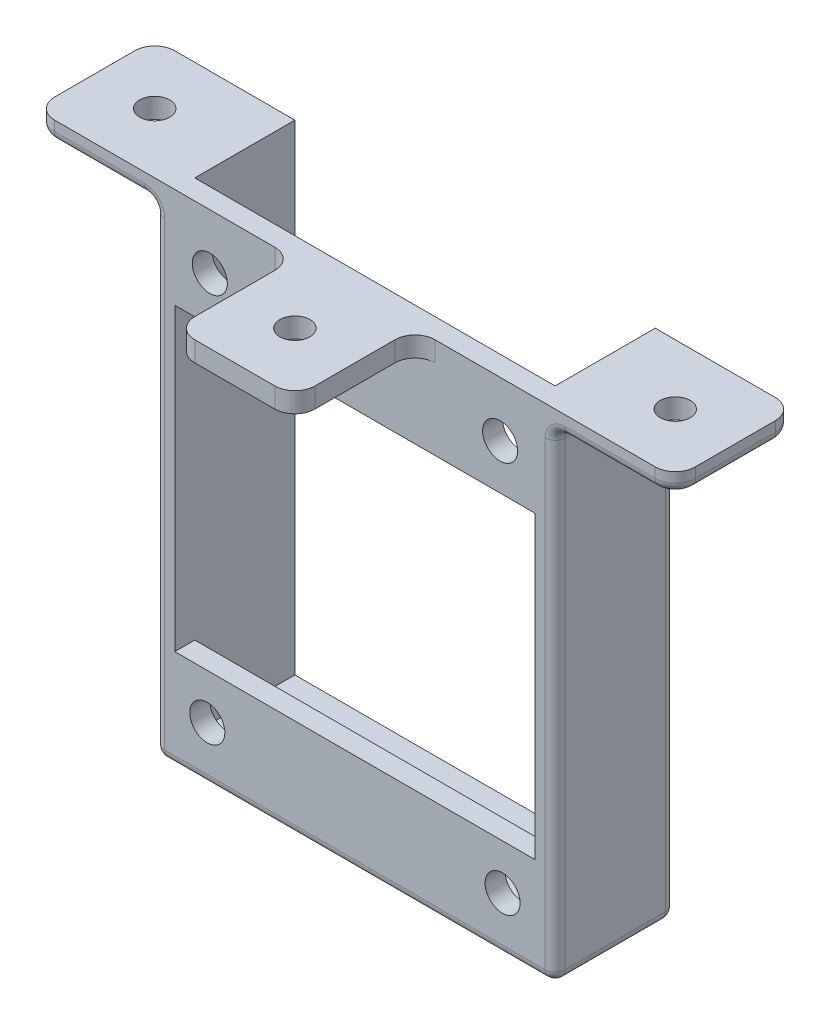
from build123d import *

# Parameters (mm, degrees)
SKETCH_3_W           = 40
SKETCH_3_H           = 50
EXTRUDE_1_DEPTH      = 12
SKETCH_5_W           = 36
SKETCH_5_H           = 46
CUT_EXTRUDE_2_DEPTH  = 10
SKETCH_7_R           = 1.75
CUT_EXTRUDE_6_DEPTH  = 3
SKETCH_11_W          = 12
SKETCH_11_H          = 2
EXTRUDE_2_DEPTH      = 12
FILLET_1_R           = 2
SKETCH_13_R          = 1.5
CUT_EXTRUDE_7_DEPTH  = 2
FILLET_4_R           = 2
SKETCH_14_W          = 12
SKETCH_14_H          = 2
EXTRUDE_3_DEPTH      = 12
FILLET_5_R           = 2
SKETCH_15_R          = 1.5
CUT_EXTRUDE_8_DEPTH  = 12
FILLET_6_R           = 1
FILLET_7_R           = 1
SKETCH_16_W          = 36
SKETCH_16_H          = 10
CUT_EXTRUDE_9_DEPTH  = 63.481997407
SKETCH_19_W          = 36
SKETCH_19_H          = 29.966821032
CUT_EXTRUDE_10_DEPTH = 3


with BuildPart() as part:
    # 草图3 → 凸台-拉伸1 (new body)
    with BuildSketch(Plane.XY):
        Rectangle(SKETCH_3_W, SKETCH_3_H)
    extrude(amount=EXTRUDE_1_DEPTH)

    # 草图5 → 切除-拉伸2 (cut)
    with BuildSketch(Plane(origin=(0, 0, 0), x_dir=(-1, 0, 0), z_dir=(0, 0, -1))):
        Rectangle(SKETCH_5_W, SKETCH_5_H)
    extrude(amount=-CUT_EXTRUDE_2_DEPTH, mode=Mode.SUBTRACT)

    # 草图7 → 切除-拉伸6 (cut)
    with BuildSketch(Plane(origin=(0, 0, 10), x_dir=(-1, 0, 0), z_dir=(0, 0, -1))):
        with Locations((14.5, 19.5)):
            Circle(SKETCH_7_R)
        with Locations((14.75, -19.5)):
            Circle(SKETCH_7_R)
        with Locations((-14.75, -19.5)):
            Circle(SKETCH_7_R)
        with Locations((-14.5, 19.5)):
            Circle(SKETCH_7_R)
    extrude(amount=-CUT_EXTRUDE_6_DEPTH, mode=Mode.SUBTRACT)

    # 草图11 → 凸台-拉伸2 (add)
    with BuildSketch(Plane(origin=(20, 0, 0), x_dir=(0, 0, -1), z_dir=(1, 0, 0))):
        with Locations((-6, 24)):
            Rectangle(SKETCH_11_W, SKETCH_11_H)
    extrude_2 = extrude(amount=EXTRUDE_2_DEPTH)

    # 圆角1
    fillet_1_edges = [part.edges().sort_by_distance(p)[0] for p in [
        (32, 24, 0),
        (32, 24, 12),
    ]]
    fillet(fillet_1_edges, radius=FILLET_1_R)

    # 草图13 → 切除-拉伸7 (cut)
    with BuildSketch(Plane.XZ.offset(-23)):
        with Locations(Location((26, 6, 0), (0, 0, 270))):
            Circle(SKETCH_13_R)
    cut_extrude_7 = extrude(amount=-CUT_EXTRUDE_7_DEPTH, mode=Mode.SUBTRACT)

    # 镜向1: 凸台-拉伸2, 切除-拉伸7 across plane
    add(extrude_2.mirror(Plane(origin=(0, 0, 0), x_dir=(0, 0, 1), z_dir=(1, 0, 0))))
    add(cut_extrude_7.mirror(Plane(origin=(0, 0, 0), x_dir=(0, 0, 1), z_dir=(1, 0, 0))), mode=Mode.SUBTRACT)

    # 圆角4
    fillet_4_edges = [part.edges().sort_by_distance(p)[0] for p in [
        (-32, 24, 0),
        (-32, 24, 12),
    ]]
    fillet(fillet_4_edges, radius=FILLET_4_R)

    # 草图14 → 凸台-拉伸3 (add)
    with BuildSketch(Plane.XY.offset(12)):
        with Locations((0, 24)):
            Rectangle(SKETCH_14_W, SKETCH_14_H)
    extrude(amount=EXTRUDE_3_DEPTH)

    # 圆角5
    fillet_5_edges = [part.edges().sort_by_distance(p)[0] for p in [
        (6, 24, 12),
        (-6, 24, 12),
        (6, 24, 24),
        (-6, 24, 24),
    ]]
    fillet(fillet_5_edges, radius=FILLET_5_R)

    # 草图15 → 切除-拉伸8 (cut)
    with BuildSketch(Plane.XZ.offset(-23)):
        with Locations(Location((0, 18, 0), (0, 0, 270))):
            Circle(SKETCH_15_R)
    extrude(amount=-CUT_EXTRUDE_8_DEPTH, mode=Mode.SUBTRACT)

    # 圆角6
    fillet_6_edges = [part.edges().sort_by_distance(p)[0] for p in [
        (0, -25, 12),
        (0, -25, 0),
        (20, 23, 6),
        (-20, -25, 6),
        (20, -25, 6),
        (-20, 23, 6),
    ]]
    fillet(fillet_6_edges, radius=FILLET_6_R)

    # 圆角7
    # the kernel refuses this fillet: 1 mm, written as the material it takes off along each edge
    with BuildSketch(Plane(origin=(19, -24, 11), x_dir=(1, 0, 0), z_dir=(0, 0, 1))) as fillet_7_piece_1_section:
        Polygon((0, 0), (FILLET_7_R, 0), (FILLET_7_R, -FILLET_7_R), (0, -FILLET_7_R), align=None)
    fillet_7_piece_1 = extrude(amount=FILLET_7_R, mode=Mode.PRIVATE)
    fillet_7_piece_1 = fillet_7_piece_1 - Plane(origin=(19, -24, 11), x_dir=(-0.7071067811865475, 0.7071067811865475, 0), z_dir=(0, 0, 1)) * Sphere(FILLET_7_R, mode=Mode.PRIVATE)
    add(fillet_7_piece_1, mode=Mode.SUBTRACT)
    with BuildSketch(Plane(origin=(19, -24, 1), x_dir=(0, 0, -1), z_dir=(1, 0, 0))) as fillet_7_piece_2_section:
        Polygon((0, 0), (FILLET_7_R, 0), (FILLET_7_R, -FILLET_7_R), (0, -FILLET_7_R), align=None)
    fillet_7_piece_2 = extrude(amount=FILLET_7_R, mode=Mode.PRIVATE)
    fillet_7_piece_2 = fillet_7_piece_2 - Plane(origin=(19, -24, 1), x_dir=(0, 0.7071067811865475, 0.7071067811865475), z_dir=(1, 0, 0)) * Sphere(FILLET_7_R, mode=Mode.PRIVATE)
    add(fillet_7_piece_2, mode=Mode.SUBTRACT)
    with BuildSketch(Plane(origin=(-19, -24, 11), x_dir=(-1, 0, 0), z_dir=(0, 0, 1))) as fillet_7_piece_3_section:
        Polygon((0, 0), (FILLET_7_R, 0), (FILLET_7_R, FILLET_7_R), (0, FILLET_7_R), align=None)
    fillet_7_piece_3 = extrude(amount=FILLET_7_R, mode=Mode.PRIVATE)
    fillet_7_piece_3 = fillet_7_piece_3 - Plane(origin=(-19, -24, 11), x_dir=(0.7071067811865475, 0.7071067811865475, 0), z_dir=(0, 0, 1)) * Sphere(FILLET_7_R, mode=Mode.PRIVATE)
    add(fillet_7_piece_3, mode=Mode.SUBTRACT)
    with BuildSketch(Plane(origin=(-19, -24, 1), x_dir=(0, 0, -1), z_dir=(-1, 0, 0))) as fillet_7_piece_4_section:
        Polygon((0, 0), (FILLET_7_R, 0), (FILLET_7_R, FILLET_7_R), (0, FILLET_7_R), align=None)
    fillet_7_piece_4 = extrude(amount=FILLET_7_R, mode=Mode.PRIVATE)
    fillet_7_piece_4 = fillet_7_piece_4 - Plane(origin=(-19, -24, 1), x_dir=(0, 0.7071067811865475, 0.7071067811865475), z_dir=(-1, 0, 0)) * Sphere(FILLET_7_R, mode=Mode.PRIVATE)
    add(fillet_7_piece_4, mode=Mode.SUBTRACT)
    with BuildSketch(Plane(origin=(-32, 23, 10), x_dir=(1, 0, 0), z_dir=(0, 0, -1))) as fillet_7_piece_5:
        with BuildLine():
            CenterArc((FILLET_7_R, -FILLET_7_R), FILLET_7_R, 90, 90)
            Line((0, -FILLET_7_R), (0, 0))
            Line((0, 0), (FILLET_7_R, 0))
        make_face()
    extrude(amount=8, mode=Mode.SUBTRACT)
    with BuildSketch(Plane(origin=(-21, 23, 12), x_dir=(0, 1, 0), z_dir=(-1, 0, 0)), Plane(origin=(-21, 23, 0), x_dir=(0, 0, 1), z_dir=(-1, 0, 0))) as fillet_7_piece_6:
        with BuildLine():
            CenterArc((FILLET_7_R, FILLET_7_R), FILLET_7_R, 180, 90)
            Line((0, FILLET_7_R), (0, 0))
            Line((0, 0), (FILLET_7_R, 0))
        make_face()
    extrude(amount=9, mode=Mode.SUBTRACT)
    with BuildSketch(Plane(origin=(-30, 23, 10), x_dir=(0, 0, 1), z_dir=(1, 0, 0))) as fillet_7_piece_7:
        with BuildLine():
            CenterArc((2 - FILLET_7_R, -FILLET_7_R), FILLET_7_R, 0, 90)
            Line((2, -FILLET_7_R), (2, 0))
            Line((2, 0), (2 - FILLET_7_R, 0))
        make_face()
    revolve(axis=Axis((-30, 23, 10), (0, -1, 0)), revolution_arc=90, mode=Mode.SUBTRACT)
    with BuildSketch(Plane(origin=(-30, 23, 2), x_dir=(-1, 0, 0), z_dir=(0, 0, 1))) as fillet_7_piece_8:
        with BuildLine():
            CenterArc((2 - FILLET_7_R, -FILLET_7_R), FILLET_7_R, 0, 90)
            Line((2, -FILLET_7_R), (2, 0))
            Line((2, 0), (2 - FILLET_7_R, 0))
        make_face()
    revolve(axis=Axis((-30, 23, 2), (0, -1, 0)), revolution_arc=90, mode=Mode.SUBTRACT)
    with BuildSketch(Plane(origin=(-20, -24, 12), x_dir=(1, 0, 0), z_dir=(0, 1, 0)), Plane(origin=(-20, -24, 0), x_dir=(0, 0, 1), z_dir=(0, 1, 0)), Plane(origin=(20, 22, 12), x_dir=(-1, 0, 0), z_dir=(0, -1, 0)), Plane(origin=(20, 22, 0), x_dir=(0, 0, 1), z_dir=(0, -1, 0))) as fillet_7_piece_9:
        with BuildLine():
            CenterArc((FILLET_7_R, FILLET_7_R), FILLET_7_R, 180, 90)
            Line((0, FILLET_7_R), (0, 0))
            Line((0, 0), (FILLET_7_R, 0))
        make_face()
    extrude(amount=46, mode=Mode.SUBTRACT)
    with BuildSketch(Plane(origin=(-21, 22, 0), x_dir=(1, 0, 0), z_dir=(0, -1, 0))) as fillet_7_piece_10:
        with BuildLine():
            CenterArc((1 + FILLET_7_R, FILLET_7_R), FILLET_7_R, 180, 90)
            Line((1 + FILLET_7_R, 0), (1, 0))
            Line((1, 0), (1, FILLET_7_R))
        make_face()
    revolve(axis=Axis((-21, 22, 0), (0, 0, 1)), revolution_arc=90, mode=Mode.SUBTRACT)
    with BuildSketch(Plane(origin=(-21, 22, 12), x_dir=(1, 0, 0), z_dir=(0, -1, 0))) as fillet_7_piece_11:
        with BuildLine():
            CenterArc((1 + FILLET_7_R, -FILLET_7_R), FILLET_7_R, 90, 90)
            Line((1, -FILLET_7_R), (1, 0))
            Line((1, 0), (1 + FILLET_7_R, 0))
        make_face()
    revolve(axis=Axis((-21, 22, 12), (0, 0, 1)), revolution_arc=90, mode=Mode.SUBTRACT)
    with BuildSketch(Plane(origin=(21, 22, 0), x_dir=(0, 1, 0), z_dir=(1, 0, 0))) as fillet_7_piece_12:
        with BuildLine():
            CenterArc((1 + FILLET_7_R, FILLET_7_R), FILLET_7_R, 180, 90)
            Line((1 + FILLET_7_R, 0), (1, 0))
            Line((1, 0), (1, FILLET_7_R))
        make_face()
    revolve(axis=Axis((21, 22, 0), (0, 0, 1)), revolution_arc=90, mode=Mode.SUBTRACT)
    with BuildSketch(Plane(origin=(21, 22, 12), x_dir=(0, 1, 0), z_dir=(1, 0, 0))) as fillet_7_piece_13:
        with BuildLine():
            CenterArc((1 + FILLET_7_R, -FILLET_7_R), FILLET_7_R, 90, 90)
            Line((1, -FILLET_7_R), (1, 0))
            Line((1, 0), (1 + FILLET_7_R, 0))
        make_face()
    revolve(axis=Axis((21, 22, 12), (0, 0, 1)), revolution_arc=90, mode=Mode.SUBTRACT)
    with BuildSketch(Plane(origin=(32, 23, 10), x_dir=(-1, 0, 0), z_dir=(0, 0, -1))) as fillet_7_piece_14:
        with BuildLine():
            CenterArc((FILLET_7_R, FILLET_7_R), FILLET_7_R, 180, 90)
            Line((0, FILLET_7_R), (0, 0))
            Line((0, 0), (FILLET_7_R, 0))
        make_face()
    extrude(amount=8, mode=Mode.SUBTRACT)
    with BuildSketch(Plane(origin=(21, 23, 0), x_dir=(0, 0, 1), z_dir=(1, 0, 0)), Plane(origin=(21, 23, 12), x_dir=(0, 1, 0), z_dir=(1, 0, 0))) as fillet_7_piece_15:
        with BuildLine():
            CenterArc((FILLET_7_R, -FILLET_7_R), FILLET_7_R, 90, 90)
            Line((0, -FILLET_7_R), (0, 0))
            Line((0, 0), (FILLET_7_R, 0))
        make_face()
    extrude(amount=9, mode=Mode.SUBTRACT)
    with BuildSketch(Plane(origin=(30, 23, 2), x_dir=(0, 0, -1), z_dir=(-1, 0, 0))) as fillet_7_piece_16:
        with BuildLine():
            CenterArc((2 - FILLET_7_R, -FILLET_7_R), FILLET_7_R, 0, 90)
            Line((2, -FILLET_7_R), (2, 0))
            Line((2, 0), (2 - FILLET_7_R, 0))
        make_face()
    revolve(axis=Axis((30, 23, 2), (0, -1, 0)), revolution_arc=90, mode=Mode.SUBTRACT)
    with BuildSketch(Plane(origin=(30, 23, 10), x_dir=(1, 0, 0), z_dir=(0, 0, -1))) as fillet_7_piece_17:
        with BuildLine():
            CenterArc((2 - FILLET_7_R, -FILLET_7_R), FILLET_7_R, 0, 90)
            Line((2, -FILLET_7_R), (2, 0))
            Line((2, 0), (2 - FILLET_7_R, 0))
        make_face()
    revolve(axis=Axis((30, 23, 10), (0, -1, 0)), revolution_arc=90, mode=Mode.SUBTRACT)

    # 草图16 → 切除-拉伸9 (cut, through all)
    with BuildSketch(Plane(origin=(0, 23, 0), x_dir=(-1, 0, 0), z_dir=(0, -1, 0))):
        with Locations((0, -5)):
            Rectangle(SKETCH_16_W, SKETCH_16_H)
    extrude(amount=-CUT_EXTRUDE_9_DEPTH, mode=Mode.SUBTRACT)

    # 草图19 → 切除-拉伸10 (cut)
    with BuildSketch(Plane.XY.offset(12)):
        Rectangle(SKETCH_19_W, SKETCH_19_H)
    extrude(amount=-CUT_EXTRUDE_10_DEPTH, mode=Mode.SUBTRACT)


solid = part.part
